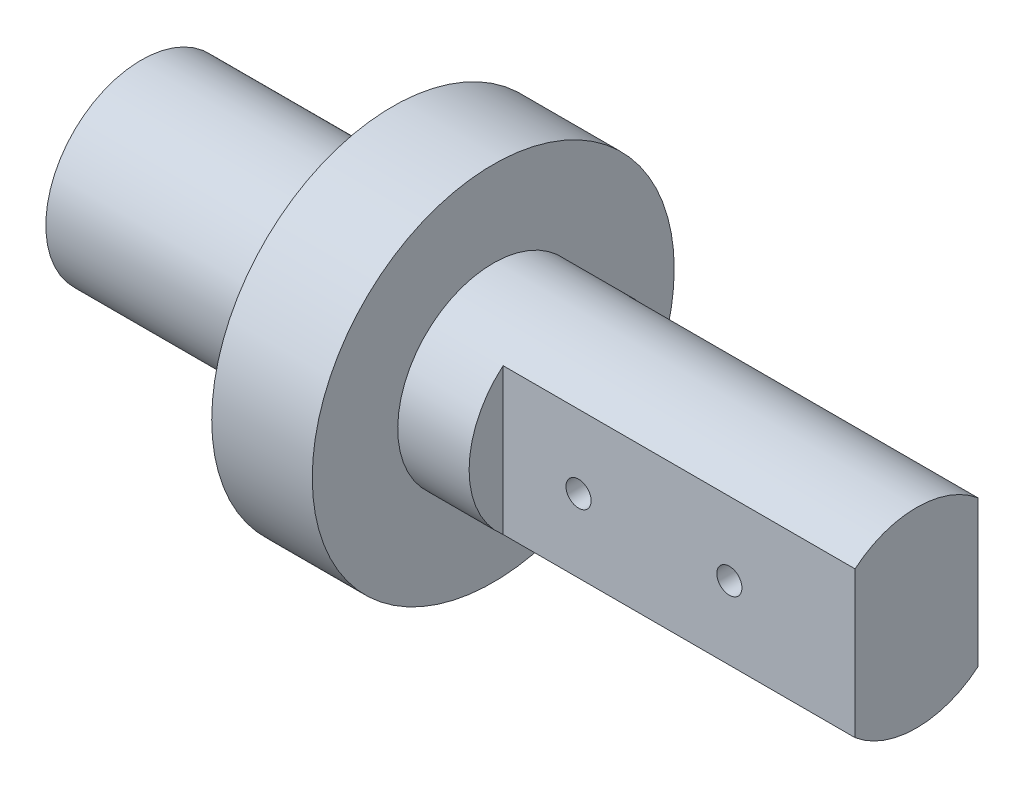
from build123d import *
from build123d.topology import SkipClean

# Parameters (mm, degrees)
SKETCH1_W                           = 42.1
SKETCH1_H                           = 10
BOSS_EXTRUDE1_START                 = 30
BOSS_EXTRUDE1_DEPTH                 = 30
BOSS_EXTRUDE2_START                 = -7.1
SKETCH8_R                           = 18
BOSS_EXTRUDE2_DEPTH                 = 10
M3X0_5_TAPPED_HOLE3_D               = 2.5
M3X0_5_TAPPED_HOLE3_DEPTH           = 10
M3X0_5_TAPPED_HOLE3_TIP             = 0.751076
M3X0_5_TAPPED_HOLE2_D               = 2.5
M3X0_5_TAPPED_HOLE2_DEPTH           = 5
M3X0_5_TAPPED_HOLE2_TIP             = 0.751076
M3X0_5_TAPPED_HOLE2_ON_FACE_2_D     = 2.5
M3X0_5_TAPPED_HOLE2_ON_FACE_2_DEPTH = 5
M3X0_5_TAPPED_HOLE2_ON_FACE_2_TIP   = 0.751076
BOSS_EXTRUDE3_START                 = 5
BOSS_EXTRUDE3_DEPTH                 = 5
TOLERANCING_START                   = 42.1
TOLERANCING_DEPTH                   = 35
TOLERANCING_2_OUTLINE_R             = 10
TOLERANCING_2_OUTLINE_R_2           = 9.5
TOLERANCING_2_DEPTH                 = 25
TOLERANCING_START_2                 = 35
TOLERANCING_3_OUTLINE_R             = 10
TOLERANCING_3_OUTLINE_R_2           = 9.5
TOLERANCING_3_DEPTH                 = 7.1


# Read off the part's stored shape, not the designer's step: Tolerancing
with BuildPart() as part:
    # Sketch1 → Revolve1 (revolve)
    with BuildSketch(Plane.XY, mode=Mode.PRIVATE) as revolve1_sk:
        with Locations((21.05, 5)):
            Rectangle(SKETCH1_W, SKETCH1_H)
    revolve(revolve1_sk.sketch.rotate(Axis((0, 0, 0), (1, 0, 0)), 90), axis=Axis((0, 0, 0), (1, 0, 0)))

    # Sketch3 → Boss-Extrude1 (add)
    with BuildSketch(Plane(origin=(42.1, 0, 0), x_dir=(0, 0, -1), z_dir=(1, 0, 0)).offset(BOSS_EXTRUDE1_START)):
        with BuildLine():
            Line((-6.614378, -7.5), (-6.614378, 7.5))
            ThreePointArc((-6.614378, 7.5), (0, 10), (6.614378, 7.5))
            Line((6.614378, 7.5), (6.614378, -7.5))
            ThreePointArc((6.614378, -7.5), (0, -10), (-6.614378, -7.5))
        make_face()
    extrude(amount=-BOSS_EXTRUDE1_DEPTH)

    # Sketch8 → Boss-Extrude2 (add)
    with BuildSketch(Plane(origin=(42.1, 0, 0), x_dir=(0, 0, -1), z_dir=(1, 0, 0)).offset(BOSS_EXTRUDE2_START)):
        Circle(SKETCH8_R)
    extrude(amount=-BOSS_EXTRUDE2_DEPTH)

    # M3x0.5 Tapped Hole3
    with Locations(Plane.XY.offset(10)):
        with Locations((20, 0)):
            Hole(M3X0_5_TAPPED_HOLE3_D / 2, depth=M3X0_5_TAPPED_HOLE3_DEPTH)
            with Locations((0, 0, -(M3X0_5_TAPPED_HOLE3_DEPTH + M3X0_5_TAPPED_HOLE3_TIP / 2))):  # 118° drill point
                Cone(0, M3X0_5_TAPPED_HOLE3_D / 2, M3X0_5_TAPPED_HOLE3_TIP, mode=Mode.SUBTRACT)

    # M3x0.5 Tapped Hole2
    with Locations(Plane(origin=(49.6, 0, 6.614378), x_dir=(1, 0, 0), z_dir=(0, 0, 1))):
        with Locations((0, 0), (15, 0)):
            Hole(M3X0_5_TAPPED_HOLE2_D / 2, depth=M3X0_5_TAPPED_HOLE2_DEPTH)
            with Locations((0, 0, -(M3X0_5_TAPPED_HOLE2_DEPTH + M3X0_5_TAPPED_HOLE2_TIP / 2))):  # 118° drill point
                Cone(0, M3X0_5_TAPPED_HOLE2_D / 2, M3X0_5_TAPPED_HOLE2_TIP, mode=Mode.SUBTRACT)

    # M3x0.5 Tapped Hole2 on face 2
    with Locations(Plane(origin=(64.6, 0, -6.614378), x_dir=(-1, 0, 0), z_dir=(0, 0, -1))):
        with Locations((0, 0), (15, 0)):
            Hole(M3X0_5_TAPPED_HOLE2_ON_FACE_2_D / 2, depth=M3X0_5_TAPPED_HOLE2_ON_FACE_2_DEPTH)
            with Locations((0, 0, -(M3X0_5_TAPPED_HOLE2_ON_FACE_2_DEPTH + M3X0_5_TAPPED_HOLE2_ON_FACE_2_TIP / 2))):  # 118° drill point
                Cone(0, M3X0_5_TAPPED_HOLE2_ON_FACE_2_D / 2, M3X0_5_TAPPED_HOLE2_ON_FACE_2_TIP, mode=Mode.SUBTRACT)

    # Sketch9 → Boss-Extrude3 (add)
    with SkipClean():  # the faces are left unmerged after this step: merging them gives an invalid solid
        with BuildSketch(Plane(origin=(72.1, 0, 0), x_dir=(0, 0, -1), z_dir=(1, 0, 0)).offset(BOSS_EXTRUDE3_START)):
            with BuildLine():
                Line((6.614378, -7.5), (6.614378, 7.5))
                ThreePointArc((6.614378, 7.5), (0, 10), (-6.614378, 7.5))
                Line((-6.614378, 7.5), (-6.614378, -7.5))
                ThreePointArc((-6.614378, -7.5), (0, -10), (6.614378, -7.5))
            make_face()
        extrude(amount=-BOSS_EXTRUDE3_DEPTH)

    # Tolerancing outline → Tolerancing (cut)
    with BuildSketch(Plane.YZ.offset(TOLERANCING_START)):
        with BuildLine():
            Line((7.5, 6.614378), (-7.5, 6.614378))
            ThreePointArc((-7.5, 6.614378), (-10, 0), (-7.5, -6.614378))
            Line((-7.5, -6.614378), (7.5, -6.614378))
            ThreePointArc((7.5, -6.614378), (10, 0), (7.5, 6.614378))
        make_face()
        with BuildLine():
            ThreePointArc((7.270789, 6.114378), (9.5, 0), (7.270789, -6.114378))
            Line((7.270789, -6.114378), (-7.270789, -6.114378))
            ThreePointArc((-7.270789, -6.114378), (-9.5, 0), (-7.270789, 6.114378))
            Line((-7.270789, 6.114378), (7.270789, 6.114378))
        make_face(mode=Mode.SUBTRACT)
    extrude(amount=TOLERANCING_DEPTH, mode=Mode.SUBTRACT)

    # Tolerancing 2 outline → Tolerancing 2 (cut)
    with BuildSketch(Plane.YZ):
        Circle(TOLERANCING_2_OUTLINE_R)
        Circle(TOLERANCING_2_OUTLINE_R_2, mode=Mode.SUBTRACT)
    extrude(amount=TOLERANCING_2_DEPTH, mode=Mode.SUBTRACT)

    # Tolerancing 3 outline → Tolerancing 3 (cut)
    with BuildSketch(Plane.YZ.offset(TOLERANCING_START_2)):
        Circle(TOLERANCING_3_OUTLINE_R)
        Circle(TOLERANCING_3_OUTLINE_R_2, mode=Mode.SUBTRACT)
    extrude(amount=TOLERANCING_3_DEPTH, mode=Mode.SUBTRACT)


solid = part.part
